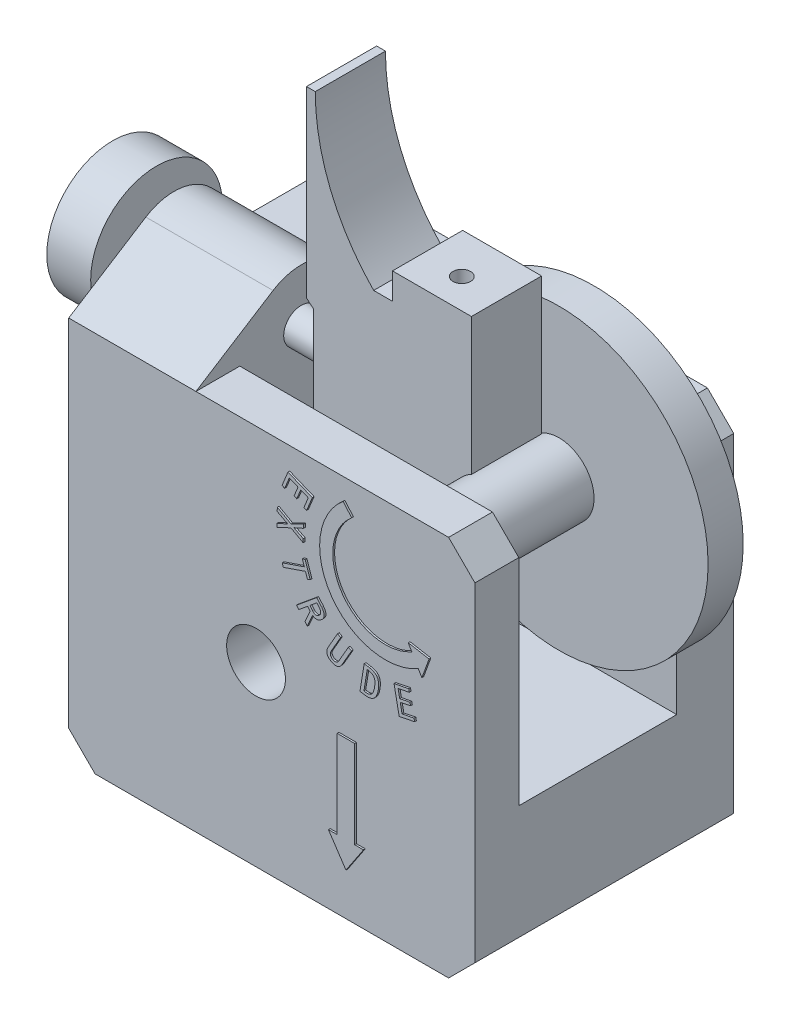
from build123d import *

# Parameters (mm, degrees)
BOSS_EXTRUDE1_START              = -21.35
BOSS_EXTRUDE1_DEPTH              = 46.3
BOSS_EXTRUDE1_START_2            = -6.85
BOSS_EXTRUDE1_2_DEPTH            = 31.8
BOSS_EXTRUDE1_3_DEPTH            = 14.5
SKETCH2_W                        = 46.3
SKETCH2_H                        = 17.979130372
BOSS_EXTRUDE2_DEPTH              = 43.5
SKETCH3_W                        = 31.8
SKETCH3_H                        = 17.979130372
CUT_EXTRUDE1_DEPTH               = 5.568363769
SKETCH4_W                        = 46.3
SKETCH4_H                        = 43.5
BOSS_EXTRUDE3_DEPTH              = 11.520869628
SKETCH5_W                        = 31.8
SKETCH5_H                        = 27.5
CUT_EXTRUDE2_DEPTH               = 0.397728376
CUT_EXTRUDE3_DEPTH               = 8
SKETCH7_W                        = 31.8
SKETCH7_H                        = 27.5
CUT_EXTRUDE4_DEPTH               = 0.811181824
SKETCH8_W                        = 31.8
SKETCH8_H                        = 27.5
CUT_EXTRUDE5_DEPTH               = 5.002271624
SKETCH9_W                        = 31.8
SKETCH9_H                        = 27.5
CUT_EXTRUDE6_DEPTH               = 3.788818176
SKETCH10_W                       = 18
SKETCH10_H                       = 8
BOSS_EXTRUDE4_DEPTH              = 31.777176766
CUT_EXTRUDE7_DEPTH               = 60.401367829
SKETCH12_W                       = 9
SKETCH12_H                       = 8
BOSS_EXTRUDE5_DEPTH              = 3
SKETCH13_W                       = 8
SKETCH13_H                       = 21.545947667
BOSS_EXTRUDE6_DEPTH              = 0.8
BOSS_EXTRUDE7_DEPTH              = 0.2
BOSS_EXTRUDE8_DEPTH              = 0.2
BOSS_EXTRUDE9_DEPTH              = 0.2
BOSS_EXTRUDE10_DEPTH             = 0.2
BOSS_EXTRUDE11_DEPTH             = 0.2
BOSS_EXTRUDE12_DEPTH             = 0.2
BOSS_EXTRUDE13_DEPTH             = 0.2
BOSS_EXTRUDE14_DEPTH             = 0.2
CUT_EXTRUDE8_DEPTH               = 0.2
BOSS_EXTRUDE15_DEPTH             = 0.2
CUT_EXTRUDE9_DEPTH               = 0.2
DRAFT1_ANGLE                     = 40
DRAFT2_ANGLE                     = -33.690067526
SKETCH26_W                       = 3.8
SKETCH26_H                       = 2
SKETCH28_W                       = 1
SKETCH28_H                       = 42.569041352
SKETCH30_W                       = 3.35
SKETCH30_H                       = 8
CBORE_FOR_M1_6_SHCS1_D           = 2
CBORE_FOR_M1_6_SHCS1_DEPTH       = 70.3
CBORE_FOR_M1_6_SHCS1_CBORE_D     = 16
CBORE_FOR_M1_6_SHCS1_CBORE_DEPTH = 12.8
F_6_7_6_7_DIAMETER_HOLE2_D       = 6.7
F_6_7_6_7_DIAMETER_HOLE2_DEPTH   = 5
F_6_7_6_7_DIAMETER_HOLE3_D       = 6.7
CHAMFER1_SIZE                    = 3


with BuildPart() as part:
    # Boss-Extrude1: read off the stored shape, not the designer's step
    # Boss-Extrude1 outline → Boss-Extrude1 (new body)
    with BuildSketch(Plane.YZ.offset(BOSS_EXTRUDE1_START)):
        with BuildLine():
            Line((28.868363769, 14.288818177), (28.868363769, 20.711181824))
            Line((28.868363769, 20.711181824), (23.3, 29.5))
            Line((23.3, 29.5), (23.3, 11.520869628))
            Line((23.3, 11.520869628), (24.299999998, 11.520869628))
            ThreePointArc((24.299999998, 11.520869628), (26.909188568, 12.368436257), (28.868363769, 14.288818177))
        make_face()
    extrude(amount=BOSS_EXTRUDE1_DEPTH)

    # Boss-Extrude1 2 outline → Boss-Extrude1 2 (add)
    with BuildSketch(Plane.YZ.offset(BOSS_EXTRUDE1_START_2)):
        Polygon((28.868363769, 20.711181824), (28.868363769, 29.5), (23.3, 29.5), align=None)
        with BuildLine():
            Line((28.868363769, 11.520869628), (28.868363769, 14.288818177))
            ThreePointArc((28.868363769, 14.288818177), (26.909188568, 12.368436257), (24.299999998, 11.520869628))
            Line((24.299999998, 11.520869628), (28.868363769, 11.520869628))
        make_face()
    extrude(amount=BOSS_EXTRUDE1_2_DEPTH)

    # Boss-Extrude1 3 outline → Boss-Extrude1 3 (add)
    with BuildSketch(Plane.YZ.offset(BOSS_EXTRUDE1_START)):
        with BuildLine():
            ThreePointArc((28.868363769, 14.288818177), (29.8, 17.5), (28.868363769, 20.711181824))
            Line((28.868363769, 20.711181824), (28.868363769, 14.288818177))
        make_face()
        with BuildLine():
            Line((24.299999998, 11.520869628), (23.3, 11.520869628))
            ThreePointArc((23.3, 11.520869628), (23.799999999, 11.5), (24.299999998, 11.520869628))
        make_face()
    extrude(amount=BOSS_EXTRUDE1_3_DEPTH)

    # Sketch2 → Boss-Extrude2 (add)
    with BuildSketch(Plane.XZ.offset(-23.3)):
        with Locations((1.8, 20.510434814)):
            Rectangle(SKETCH2_W, SKETCH2_H)
    extrude(amount=BOSS_EXTRUDE2_DEPTH)

    # Sketch3 → Cut-Extrude1 (cut)
    with BuildSketch(Plane(origin=(0, 28.868363769, 0), x_dir=(-1, 0, 0), z_dir=(0, 1, 0))):
        with Locations((-9.05, 20.510434814)):
            Rectangle(SKETCH3_W, SKETCH3_H)
    extrude(amount=-CUT_EXTRUDE1_DEPTH, mode=Mode.SUBTRACT)

    # Sketch4 → Boss-Extrude3 (add)
    with BuildSketch(Plane(origin=(0, 0, 11.520869628), x_dir=(-1, 0, 0), z_dir=(0, 0, -1))):
        with Locations((-1.8, 1.55)):
            Rectangle(SKETCH4_W, SKETCH4_H)
    extrude(amount=BOSS_EXTRUDE3_DEPTH)

    # Sketch5 → Cut-Extrude2 (cut)
    with BuildSketch(Plane(origin=(0, 0, 11.502271624), x_dir=(-1, 0, 0), z_dir=(0, 0, -1))):
        with Locations((-9.05, 9.55)):
            Rectangle(SKETCH5_W, SKETCH5_H)
    extrude(amount=-CUT_EXTRUDE2_DEPTH, mode=Mode.SUBTRACT)

    # Sketch6 → Cut-Extrude3 (cut)
    with BuildSketch(Plane(origin=(0, 0, 11.9), x_dir=(-1, 0, 0), z_dir=(0, 0, -1))):
        with BuildLine():
            Line((3.05, 17.885159875), (4.969621942, 0.550325138))
            ThreePointArc((4.969621942, 0.550325138), (4.516282317, -2.145505542), (2.712931993, -4.2))
            Line((2.712931993, -4.2), (6.85, -4.2))
            Line((6.85, -4.2), (6.85, 23.3))
            Line((6.85, 23.3), (-24.95, 23.3))
            Line((-24.95, 23.3), (-24.95, -4.2))
            Line((-24.95, -4.2), (-2.712931993, -4.2))
            ThreePointArc((-2.712931993, -4.2), (-3.711473835, -3.350367439), (-4.454820481, -2.270368799))
            Line((-4.454820481, -2.270368799), (-14.95, 18.322823234))
            Line((-14.95, 18.322823234), (3.05, 18.322823234))
            Line((3.05, 18.322823234), (3.05, 17.885159875))
        make_face()
    extrude(amount=-CUT_EXTRUDE3_DEPTH, mode=Mode.SUBTRACT)

    # Sketch7 → Cut-Extrude4 (cut)
    with BuildSketch(Plane(origin=(0, 0, 19.9), x_dir=(-1, 0, 0), z_dir=(0, 0, -1))):
        with Locations((-9.05, 9.55)):
            Rectangle(SKETCH7_W, SKETCH7_H)
    extrude(amount=-CUT_EXTRUDE4_DEPTH, mode=Mode.SUBTRACT)

    # Sketch8 → Cut-Extrude5 (cut)
    with BuildSketch(Plane.XY.offset(11.502271624)):
        with Locations((9.05, 9.55)):
            Rectangle(SKETCH8_W, SKETCH8_H)
    extrude(amount=-CUT_EXTRUDE5_DEPTH, mode=Mode.SUBTRACT)

    # Sketch9 → Cut-Extrude6 (cut)
    with BuildSketch(Plane(origin=(0, 0, 20.711181824), x_dir=(-1, 0, 0), z_dir=(0, 0, -1))):
        with Locations((-9.05, 9.55)):
            Rectangle(SKETCH9_W, SKETCH9_H)
    extrude(amount=-CUT_EXTRUDE6_DEPTH, mode=Mode.SUBTRACT)

    # Sketch10 → Boss-Extrude4 (add)
    with BuildSketch(Plane(origin=(0, 18.322823234, 0), x_dir=(-1, 0, 0), z_dir=(0, 1, 0))):
        with Locations((-5.95, 15.9)):
            Rectangle(SKETCH10_W, SKETCH10_H)
    extrude(amount=BOSS_EXTRUDE4_DEPTH)

    # Sketch11 → Cut-Extrude7 (cut, through all)
    with BuildSketch(Plane.XY.offset(19.9)):
        with BuildLine():
            Line((3.806741278, 33.8), (14.95, 33.8))
            Line((14.95, 33.8), (14.95, 50.1))
            Line((14.95, 50.1), (-2.85, 50.1))
            ThreePointArc((-2.85, 50.1), (-1.121671661, 41.296560268), (3.806741278, 33.8))
        make_face()
    extrude(amount=-CUT_EXTRUDE7_DEPTH, mode=Mode.SUBTRACT)

    # Sketch12 → Boss-Extrude5 (add)
    with BuildSketch(Plane(origin=(0, 33.8, 0), x_dir=(-1, 0, 0), z_dir=(0, 1, 0))):
        with Locations((-10.45, 15.9)):
            Rectangle(SKETCH12_W, SKETCH12_H)
    extrude(amount=BOSS_EXTRUDE5_DEPTH)

    # Sketch13 → Boss-Extrude6 (add)
    with BuildSketch(Plane.ZY.offset(3.05)):
        with Locations((15.9, 39.327026167)):
            Rectangle(SKETCH13_W, SKETCH13_H)
    extrude(amount=BOSS_EXTRUDE6_DEPTH)

    # Sketch14 → Boss-Extrude7 (add)
    with BuildSketch(Plane.XY.offset(29.5)):
        Polygon((3.161137771, 19.127854441), (3.836901254, 20.784774519), (6.614785967, 19.651833303), (5.972149963, 18.076139252), (5.663500652, 18.201299885), (6.154010336, 19.403407157), (5.293041605, 19.75488498), (4.842099435, 18.650271595), (4.533457459, 18.776327475), (4.98439963, 19.880940861), (3.993496446, 20.285099405), (3.469779747, 19.001798561), align=None)
    extrude(amount=BOSS_EXTRUDE7_DEPTH)

    # Sketch15 → Boss-Extrude8 (add)
    with BuildSketch(Plane.XY.offset(29.5)):
        Polygon((2.566277126, 14.670139538), (2.578622805, 15.09119217), (3.822937295, 15.653245451), (2.611761207, 16.284174626), (2.623457113, 16.705227258), (4.179662441, 15.836481319), (5.620858023, 16.533687297), (5.609162116, 16.112634665), (4.507147821, 15.634402046), (5.580572123, 15.095090805), (5.568876216, 14.674038174), (4.168616307, 15.450516406), align=None)
    extrude(amount=BOSS_EXTRUDE8_DEPTH)

    # Sketch16 → Boss-Extrude9 (add)
    with BuildSketch(Plane.XY.offset(29.5)):
        Polygon((18.272426359, 3.357614992), (16.516076614, 3.006810198), (15.92803243, 5.950929757), (17.598597732, 6.284912862), (17.664224763, 5.958077255), (16.390020734, 5.703366404), (16.571957056, 4.790435929), (17.742847245, 5.024354058), (17.808474275, 4.69751845), (16.637584087, 4.463600322), (16.847486289, 3.412923186), (18.207443399, 3.684612731), align=None)
    extrude(amount=BOSS_EXTRUDE9_DEPTH)

    # Sketch17 → Boss-Extrude10 (add)
    with BuildSketch(Plane.XY.offset(29.5)):
        with BuildLine():
            Line((8.428171795, 5.806632405), (9.48990019, 7.653935849))
            Line((9.48990019, 7.653935849), (9.840777383, 7.452506349))
            Line((9.840777383, 7.452506349), (8.779031312, 5.605172154))
            add(Edge.make_bspline(
                [(8.779031312, 5.605172154), (8.489681329, 5.114654622), (8.931727868, 4.845588008)],
                knots=[2.817173791, 2.817173791, 2.817173791, 3.401852099, 3.401852099, 3.401852099], degree=2, weights=[1, 0.957572368, 1]))
            add(Edge.make_bspline(
                [(8.931727868, 4.845588008), (9.385453532, 4.604081174), (9.664671338, 5.095750451)],
                knots=[2.962924911, 2.962924911, 2.962924911, 3.361487897, 3.361487897, 3.361487897], degree=2, weights=[1, 0.98020907, 1]))
            Line((9.664671338, 5.095750451), (10.726399733, 6.943053895))
            Line((10.726399733, 6.943053895), (11.077944375, 6.741005374))
            Line((11.077944375, 6.741005374), (10.016215979, 4.893701931))
            add(Edge.make_bspline(
                [(8.765403764, 4.555820189), (9.540669635, 4.104099569), (10.016215979, 4.893701931)],
                knots=[3.061520811, 3.061520811, 3.061520811, 3.226203218, 3.226203218, 3.226203218], degree=2, weights=[1, 0.996611878, 1]))
            add(Edge.make_bspline(
                [(8.428171795, 5.806632405), (7.97232425, 4.997358014), (8.765403764, 4.555820189)],
                knots=[2.845316159, 2.845316159, 2.845316159, 3.42296769, 3.42296769, 3.42296769], degree=2, weights=[1, 0.95857899, 1]))
        make_face()
    extrude(amount=BOSS_EXTRUDE10_DEPTH)

    # Sketch18 → Boss-Extrude11 (add)
    with BuildSketch(Plane.XY.offset(29.5)):
        Polygon((6.059394262, 11.318817308), (5.832623631, 11.981585339), (3.314105113, 11.119337126), (3.183500824, 11.500103857), (5.702019343, 12.36235207), (5.475248712, 13.025120102), (5.789738641, 13.13298235), (6.37388419, 11.426679556), align=None)
    extrude(amount=BOSS_EXTRUDE11_DEPTH)

    # Sketch19 → Boss-Extrude12 (add)
    with BuildSketch(Plane.XY.offset(29.5)):
        Polygon((9.45, -2.2), (11.45, -2.2), (11.45, -12.2), (12.45, -12.2), (8.45, -18.2), (8.45, -12.2), (9.45, -12.2), align=None)
    extrude(amount=BOSS_EXTRUDE12_DEPTH)

    # Sketch20 → Boss-Extrude13 (add)
    with BuildSketch(Plane.XY.offset(29.5)):
        with BuildLine():
            Line((10.129092927, 21.045333323), (11.093274342, 19.896266659))
            ThreePointArc((11.093274342, 19.896266659), (10.035087734, 11.858541382), (17.95, 10.103847577))
            Line((17.95, 10.103847577), (17.55, 10.7966679))
            Line((17.55, 10.7966679), (19.924737774, 10.377937559))
            Line((19.924737774, 10.377937559), (19.1, 8.111989149))
            Line((19.1, 8.111989149), (18.7, 8.804809472))
            ThreePointArc((18.7, 8.804809472), (8.806359668, 10.998176727), (10.129092927, 21.045333323))
        make_face()
    extrude(amount=BOSS_EXTRUDE13_DEPTH)

    # Sketch21 → Boss-Extrude14 (add)
    with BuildSketch(Plane.XY.offset(29.5)):
        with BuildLine():
            Line((6.037198806, 6.676504627), (5.770142275, 7.000091372))
            Line((5.770142275, 7.000091372), (6.367283276, 8.307433802))
            Line((6.367283276, 8.307433802), (6.078784251, 8.657661222))
            Line((6.078784251, 8.657661222), (5.081383341, 7.835698909))
            Line((5.081383341, 7.835698909), (4.825403195, 8.146315134))
            Line((4.825403195, 8.146315134), (7.130821238, 10.046219906))
            Line((7.130821238, 10.046219906), (7.686971385, 9.371761287))
            add(Edge.make_bspline(
                [(7.625892763, 8.099506576), (8.277400572, 8.619070364), (7.686971385, 9.371761287)],
                knots=[6.157152415, 6.157152415, 6.157152415, 6.451049959, 6.451049959, 6.451049959], degree=2, weights=[1, 0.989222444, 1]))
            add(Edge.make_bspline(
                [(6.653183211, 8.044275907), (7.161308813, 7.701214914), (7.625892763, 8.099506576)],
                knots=[2.86367182, 2.86367182, 2.86367182, 3.41782655, 3.41782655, 3.41782655], degree=2, weights=[1, 0.961859019, 1]))
            Line((6.653183211, 8.044275907), (6.037198806, 6.676504627))
        make_face()
    extrude(amount=BOSS_EXTRUDE14_DEPTH)

    # Sketch22 → Cut-Extrude8 (cut)
    with BuildSketch(Plane.XY.offset(29.7)):
        with BuildLine():
            Line((6.335481197, 8.869442475), (6.646685485, 8.491969215))
            add(Edge.make_bspline(
                [(6.646685485, 8.491969215), (6.669323917, 8.466507951), (6.713532712, 8.416786672), (6.791492799, 8.35640958), (6.875961662, 8.310210346), (6.95127813, 8.283342389), (7.014218502, 8.270149269), (7.063104614, 8.269541055), (7.112847548, 8.274281139), (7.163075091, 8.288036718), (7.214314849, 8.307680481), (7.266278695, 8.334610318), (7.31916889, 8.368516508), (7.353007017, 8.395482254), (7.370532139, 8.409448097)],
                knots=[0, 0, 0, 0, 0.122933876, 0.240067798, 0.354277149, 0.469655663, 0.527844701, 0.585796286, 0.645621114, 0.707900251, 0.773322753, 0.843696, 0.919048515, 1, 1, 1, 1], degree=3))
            add(Edge.make_bspline(
                [(7.370532139, 8.409448097), (7.385759841, 8.422359172), (7.415492543, 8.447568566), (7.454163085, 8.489384067), (7.487993664, 8.531963967), (7.516070926, 8.576407447), (7.538845277, 8.622323184), (7.555957, 8.669867159), (7.567813614, 8.71864184), (7.573564333, 8.769249632), (7.573833698, 8.821422998), (7.56634762, 8.875349939), (7.551693791, 8.930541656), (7.530827671, 8.987757066), (7.501782973, 9.045891185), (7.466406218, 9.106022739), (7.424232863, 9.167815935), (7.391832552, 9.208022981), (7.375080547, 9.22881132)],
                knots=[0, 0, 0, 0, 0.063881873, 0.124731936, 0.18203946, 0.237845513, 0.292752005, 0.345849901, 0.399349495, 0.453122677, 0.508613159, 0.566000384, 0.626901819, 0.691200329, 0.760688172, 0.834682706, 0.914525631, 1, 1, 1, 1], degree=3))
            Line((7.375080547, 9.22881132), (7.130787362, 9.525125182))
            Line((7.130787362, 9.525125182), (6.335481197, 8.869442475))
        make_face()
    extrude(amount=-CUT_EXTRUDE8_DEPTH, mode=Mode.SUBTRACT)

    # Sketch23 → Boss-Extrude15 (add)
    with BuildSketch(Plane.XY.offset(29.5)):
        with BuildLine():
            Line((12.634746456, 3.152600802), (12.043454859, 3.24942577))
            Line((12.043454859, 3.24942577), (12.530134521, 6.22148555))
            Line((12.530134521, 6.22148555), (13.121426118, 6.124660581))
            add(Edge.make_bspline(
                [(13.121426118, 6.124660581), (13.17313457, 6.115013293), (13.273259886, 6.096332833), (13.416335785, 6.056890665), (13.546629122, 6.007280236), (13.665361323, 5.950043454), (13.770752365, 5.881644723), (13.864572955, 5.805132653), (13.945113838, 5.718185767), (14.014570123, 5.622443619), (14.070788575, 5.514888637), (14.114819789, 5.3956171), (14.14727403, 5.264215067), (14.166562658, 5.120245542), (14.175684534, 4.963851398), (14.17183131, 4.794904289), (14.155854949, 4.613570549), (14.137464402, 4.489315791), (14.127923844, 4.424855513)],
                knots=[0, 0, 0, 0, 0.06914613, 0.133890647, 0.194823605, 0.252266258, 0.30685275, 0.359653739, 0.41103785, 0.46225437, 0.514741056, 0.570073558, 0.629062017, 0.692336021, 0.760803168, 0.834863726, 0.914331407, 1, 1, 1, 1], degree=3))
            add(Edge.make_bspline(
                [(14.127923844, 4.424855513), (14.116328721, 4.360808754), (14.093941574, 4.237151225), (14.049452024, 4.060885025), (13.996009518, 3.90090545), (13.935675846, 3.756325025), (13.865316872, 3.628370263), (13.787111076, 3.515989521), (13.700755281, 3.419473122), (13.605014517, 3.340048341), (13.50275363, 3.27503877), (13.395289936, 3.221250748), (13.28172948, 3.180433784), (13.163017523, 3.150081005), (13.038352026, 3.1329556), (12.908318835, 3.127340067), (12.772812031, 3.132946597), (12.681446699, 3.145952829), (12.634746456, 3.152600802)],
                knots=[0, 0, 0, 0, 0.086893083, 0.167767804, 0.242485978, 0.311941247, 0.376660877, 0.437076771, 0.494407715, 0.549025121, 0.602614498, 0.655901018, 0.709147498, 0.763437745, 0.819224834, 0.876835201, 0.937045858, 1, 1, 1, 1], degree=3))
        make_face()
    extrude(amount=BOSS_EXTRUDE15_DEPTH)

    # Sketch24 → Cut-Extrude9 (cut)
    with BuildSketch(Plane.XY.offset(29.7)):
        with BuildLine():
            Line((12.497645892, 3.51388321), (12.68867903, 3.482694127))
            add(Edge.make_bspline(
                [(12.68867903, 3.482694127), (12.722408688, 3.478017987), (12.788144091, 3.468904705), (12.884948714, 3.464936503), (12.976815, 3.469955244), (13.063437574, 3.483943555), (13.144679167, 3.507642795), (13.220827073, 3.539456211), (13.291539664, 3.580831758), (13.357577718, 3.631569178), (13.41901724, 3.693694853), (13.47474388, 3.769144979), (13.525313709, 3.858023872), (13.571695007, 3.959451846), (13.614087559, 4.074106599), (13.651141097, 4.202125996), (13.68439736, 4.343308401), (13.701753819, 4.442306296), (13.710771298, 4.49374026)],
                knots=[0, 0, 0, 0, 0.061697288, 0.120241244, 0.175294107, 0.22821867, 0.278910483, 0.328347753, 0.3774346, 0.426983981, 0.47889706, 0.535273654, 0.596484378, 0.663937514, 0.737227622, 0.817851043, 0.905365231, 1, 1, 1, 1], degree=3))
            add(Edge.make_bspline(
                [(13.710771298, 4.49374026), (13.718646815, 4.545438823), (13.733797078, 4.644892211), (13.747474414, 4.789563434), (13.753090872, 4.923204364), (13.750105384, 5.046100311), (13.739042362, 5.158394882), (13.718359808, 5.259806006), (13.690046711, 5.350728592), (13.652774385, 5.431244489), (13.606425755, 5.502247969), (13.552851376, 5.56591685), (13.490970687, 5.622063757), (13.421957884, 5.671937437), (13.344248614, 5.713265261), (13.259406536, 5.748818214), (13.166143904, 5.775691469), (13.100964016, 5.788175074), (13.067496444, 5.794584965)],
                knots=[0, 0, 0, 0, 0.094108185, 0.181037489, 0.261403659, 0.334718213, 0.40213569, 0.464215936, 0.520681224, 0.573175704, 0.623347705, 0.672862658, 0.722529303, 0.773375268, 0.825705926, 0.880582476, 0.938683317, 1, 1, 1, 1], degree=3))
            Line((13.067496444, 5.794584965), (12.876463306, 5.825774049))
            Line((12.876463306, 5.825774049), (12.497645892, 3.51388321))
        make_face()
    extrude(amount=-CUT_EXTRUDE9_DEPTH, mode=Mode.SUBTRACT)

    # Draft1
    draft1_faces = [part.faces().sort_by_distance(p)[0] for p in [
        (-3.45, 28.554052333, 15.9),
    ]]
    draft(draft1_faces, Plane(origin=(-3.05, 18.322823234, 19.9), x_dir=(0, -1, 0), z_dir=(-1, 0, 0)), DRAFT1_ANGLE)

    # Draft2
    draft2_faces = [part.faces().sort_by_distance(p)[0] for p in [
        (8.45, -15.2, 29.6),
    ]]
    draft(draft2_faces, Plane(origin=(8.45, -12.2, 29.7), x_dir=(0, 0, 1), z_dir=(0, 1, 0)), DRAFT2_ANGLE)

    # Sketch25 → Revolve1 (revolve)
    with BuildSketch(Plane(origin=(0, 0, 17.5), x_dir=(-1, 0, 0), z_dir=(0, 0, -1)), mode=Mode.PRIVATE) as revolve1_sk:
        Polygon((21.35, 25.8), (21.35, 23.8), (28.35, 23.8), (28.35, 31.3), (23.35, 31.3), (23.35, 25.8), align=None)
    revolve(revolve1_sk.sketch.rotate(Axis((-21.35, 23.8, 17.5), (-1, 0, 0)), 270), axis=Axis((-21.35, 23.8, 17.5), (-1, 0, 0)))

    # Sketch26 → Revolve2 (revolve)
    with BuildSketch(Plane(origin=(0, 0, 17.5), x_dir=(-1, 0, 0), z_dir=(0, 0, -1)), mode=Mode.PRIVATE) as revolve2_sk:
        with Locations((4.95, 24.8)):
            Rectangle(SKETCH26_W, SKETCH26_H)
    revolve(revolve2_sk.sketch.rotate(Axis((-3.05, 23.8, 17.5), (-1, 0, 0)), 270), axis=Axis((-3.05, 23.8, 17.5), (-1, 0, 0)))

    # Sketch27 → Revolve3 (revolve)
    with BuildSketch(Plane(origin=(0, 17.621735549, 0), x_dir=(1, 0, 0), z_dir=(0, 1, 0))):
        Polygon((16.728053993, -6.5), (12.728053993, -6.5), (12.728053993, -7.7), (-0.271946007, -7.7), (-0.271946007, -11.7), (12.728053993, -11.7), (12.728053993, -24.5), (16.728053993, -24.5), align=None)
    revolve(axis=Axis((16.728053993, 17.621735549, 24.5), (0, 0, -1)))

    # Sketch28 → Ø2.0 (2) Diameter Hole1 (revolve, cut)
    with BuildSketch(Plane(origin=(10.45, 7.530958648, 16.5), x_dir=(0, 0, -1), z_dir=(1, 0, 0))):
        with Locations((0.5, 21.284520676)):
            Rectangle(SKETCH28_W, SKETCH28_H)
    revolve(axis=Axis((10.45, 1.180958648, 16.5), (0, 1, 0)), mode=Mode.SUBTRACT)

    # Sketch30 → Ø6.7 (6.7) Diameter Hole1 (revolve, cut)
    with BuildSketch(Plane(origin=(0, 0, 11.9), x_dir=(0, 1, 0), z_dir=(1, 0, 0))):
        with Locations((1.675, 4)):
            Rectangle(SKETCH30_W, SKETCH30_H)
    revolve(axis=Axis((0, 0, 5.55), (0, 0, 1)), mode=Mode.SUBTRACT)

    # CBORE for M1.6 SHCS1
    with Locations(Plane(origin=(0, -20.2, 0), x_dir=(-1, 0, 0), z_dir=(0, -1, 0))):
        with Locations((-10.45, -16.5)):
            CounterBoreHole(CBORE_FOR_M1_6_SHCS1_D / 2, CBORE_FOR_M1_6_SHCS1_CBORE_D / 2, CBORE_FOR_M1_6_SHCS1_CBORE_DEPTH, depth=CBORE_FOR_M1_6_SHCS1_DEPTH)

    # Ø6.7 (6.7) Diameter Hole2
    with Locations(Plane.XY.offset(29.5)):
        with Locations((0, 0)):
            Hole(F_6_7_6_7_DIAMETER_HOLE2_D / 2, depth=F_6_7_6_7_DIAMETER_HOLE2_DEPTH)

    # Ø6.7 (6.7) Diameter Hole3 (through all)
    with Locations(Plane.XY.offset(6.5)):
        with Locations((0, 0)):
            Hole(F_6_7_6_7_DIAMETER_HOLE3_D / 2)

    # Chamfer1
    chamfer1_edges = [part.edges().sort_by_distance(p)[0] for p in [
        (24.95, -20.2, 14.75),
        (-21.35, -20.2, 14.75),
        (24.95, 23.3, 27),
        (24.95, 23.3, 3.25),
    ]]
    chamfer(chamfer1_edges, length=CHAMFER1_SIZE)


solid = part.part
